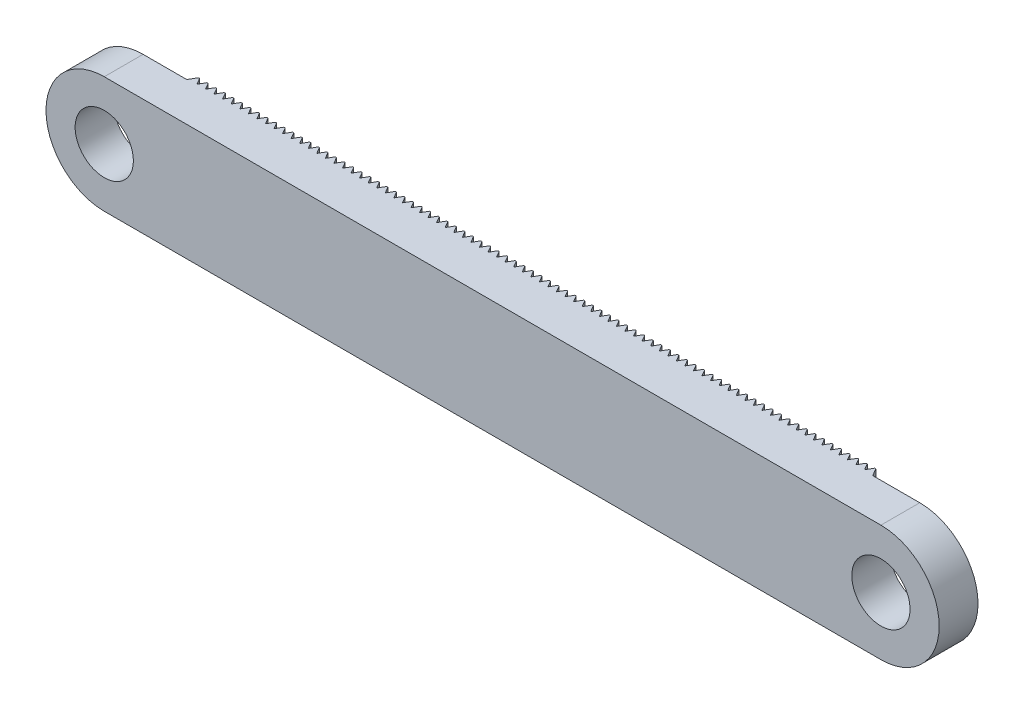
from build123d import *

# Parameters (mm, degrees)
SKETCH1_R           = 1.5
BOSS_EXTRUDE1_DEPTH = 2
BOSS_EXTRUDE6_DEPTH = 3


with BuildPart() as part:
    # Sketch1 → Boss-Extrude1 (new body)
    with BuildSketch(Plane.XY):
        with BuildLine():
            Line((-20, 3), (20, 3))
            ThreePointArc((20, 3), (23, 0), (20, -3))
            Line((20, -3), (-20, -3))
            ThreePointArc((-20, -3), (-23, 0), (-20, 3))
        make_face()
        with Locations((-20, 0)):
            Circle(SKETCH1_R, mode=Mode.SUBTRACT)
        with Locations(Location((20, 0, 0), (0, 0, 180))):
            Circle(SKETCH1_R, mode=Mode.SUBTRACT)
    extrude(amount=BOSS_EXTRUDE1_DEPTH)

    # Sketch5 → Boss-Extrude6 (add, symmetric)
    with BuildSketch(Plane(origin=(0, 0, 0), x_dir=(1, 0, 0), z_dir=(0, 1, 0))):
        Polygon((-17.469393102, 0.38), (-17.530606898, 0.38), (-17.75, 0), (17.576728926, 0), (17.357335823, 0.38), (17.296122028, 0.38), (17.106306591, 0.051230019), (16.916491153, 0.38), (16.855277358, 0.38), (16.665461921, 0.051230019), (16.475646483, 0.38), (16.414432688, 0.38), (16.224617251, 0.051230019), (16.034801814, 0.38), (15.973588018, 0.38), (15.783772581, 0.051230019), (15.593957144, 0.38), (15.532743348, 0.38), (15.342927911, 0.051230019), (15.153112474, 0.38), (15.091898678, 0.38), (14.902083241, 0.051230019), (14.712267804, 0.38), (14.651054008, 0.38), (14.461238571, 0.051230019), (14.271423134, 0.38), (14.210209338, 0.38), (14.020393901, 0.051230019), (13.830578464, 0.38), (13.769364668, 0.38), (13.579549231, 0.051230019), (13.389733794, 0.38), (13.328519998, 0.38), (13.138704561, 0.051230019), (12.948889124, 0.38), (12.887675329, 0.38), (12.697859891, 0.051230019), (12.508044454, 0.38), (12.446830659, 0.38), (12.257015221, 0.051230019), (12.067199784, 0.38), (12.005985989, 0.38), (11.816170551, 0.051230019), (11.626355114, 0.38), (11.565141319, 0.38), (11.375325881, 0.051230019), (11.185510444, 0.38), (11.124296649, 0.38), (10.934481211, 0.051230019), (10.744665774, 0.38), (10.683451979, 0.38), (10.493636542, 0.051230019), (10.303821104, 0.38), (10.242607309, 0.38), (10.052791872, 0.051230019), (9.862976434, 0.38), (9.801762639, 0.38), (9.611947202, 0.051230019), (9.422131764, 0.38), (9.360917969, 0.38), (9.171102532, 0.051230019), (8.981287094, 0.38), (8.920073299, 0.38), (8.730257862, 0.051230019), (8.540442424, 0.38), (8.479228629, 0.38), (8.289413192, 0.051230019), (8.099597755, 0.38), (8.038383959, 0.38), (7.848568522, 0.051230019), (7.658753085, 0.38), (7.597539289, 0.38), (7.407723852, 0.051230019), (7.217908415, 0.38), (7.156694619, 0.38), (6.966879182, 0.051230019), (6.777063745, 0.38), (6.715849949, 0.38), (6.526034512, 0.051230019), (6.336219075, 0.38), (6.275005279, 0.38), (6.085189842, 0.051230019), (5.895374405, 0.38), (5.834160609, 0.38), (5.644345172, 0.051230019), (5.454529735, 0.38), (5.393315939, 0.38), (5.203500502, 0.051230019), (5.013685065, 0.38), (4.952471269, 0.38), (4.762655832, 0.051230019), (4.572840395, 0.38), (4.5116266, 0.38), (4.321811162, 0.051230019), (4.131995725, 0.38), (4.07078193, 0.38), (3.880966492, 0.051230019), (3.691151055, 0.38), (3.62993726, 0.38), (3.440121822, 0.051230019), (3.250306385, 0.38), (3.18909259, 0.38), (2.999277152, 0.051230019), (2.809461715, 0.38), (2.74824792, 0.38), (2.558432483, 0.051230019), (2.368617045, 0.38), (2.30740325, 0.38), (2.117587813, 0.051230019), (1.927772375, 0.38), (1.86655858, 0.38), (1.676743143, 0.051230019), (1.486927705, 0.38), (1.42571391, 0.38), (1.235898473, 0.051230019), (1.046083035, 0.38), (0.98486924, 0.38), (0.795053803, 0.051230019), (0.605238365, 0.38), (0.54402457, 0.38), (0.354209133, 0.051230019), (0.164393696, 0.38), (0.1031799, 0.38), (-0.086635537, 0.051230019), (-0.276450974, 0.38), (-0.33766477, 0.38), (-0.527480207, 0.051230019), (-0.717295644, 0.38), (-0.77850944, 0.38), (-0.968324877, 0.051230019), (-1.158140314, 0.38), (-1.21935411, 0.38), (-1.409169547, 0.051230019), (-1.598984984, 0.38), (-1.66019878, 0.38), (-1.850014217, 0.051230019), (-2.039829654, 0.38), (-2.10104345, 0.38), (-2.290858887, 0.051230019), (-2.480674324, 0.38), (-2.54188812, 0.38), (-2.731703557, 0.051230019), (-2.921518994, 0.38), (-2.98273279, 0.38), (-3.172548227, 0.051230019), (-3.362363664, 0.38), (-3.423577459, 0.38), (-3.613392897, 0.051230019), (-3.803208334, 0.38), (-3.864422129, 0.38), (-4.054237567, 0.051230019), (-4.244053004, 0.38), (-4.305266799, 0.38), (-4.495082237, 0.051230019), (-4.684897674, 0.38), (-4.746111469, 0.38), (-4.935926907, 0.051230019), (-5.125742344, 0.38), (-5.186956139, 0.38), (-5.376771577, 0.051230019), (-5.566587014, 0.38), (-5.627800809, 0.38), (-5.817616246, 0.051230019), (-6.007431684, 0.38), (-6.068645479, 0.38), (-6.258460916, 0.051230019), (-6.448276354, 0.38), (-6.509490149, 0.38), (-6.699305586, 0.051230019), (-6.889121024, 0.38), (-6.950334819, 0.38), (-7.140150256, 0.051230019), (-7.329965694, 0.38), (-7.391179489, 0.38), (-7.580994926, 0.051230019), (-7.770810363, 0.38), (-7.832024159, 0.38), (-8.021839596, 0.051230019), (-8.211655033, 0.38), (-8.272868829, 0.38), (-8.462684266, 0.051230019), (-8.652499703, 0.38), (-8.713713499, 0.38), (-8.903528936, 0.051230019), (-9.093344373, 0.38), (-9.154558169, 0.38), (-9.344373606, 0.051230019), (-9.534189043, 0.38), (-9.595402839, 0.38), (-9.785218276, 0.051230019), (-9.975033713, 0.38), (-10.036247509, 0.38), (-10.226062946, 0.051230019), (-10.415878383, 0.38), (-10.477092179, 0.38), (-10.666907616, 0.051230019), (-10.856723053, 0.38), (-10.917936849, 0.38), (-11.107752286, 0.051230019), (-11.297567723, 0.38), (-11.358781518, 0.38), (-11.548596956, 0.051230019), (-11.738412393, 0.38), (-11.799626188, 0.38), (-11.989441626, 0.051230019), (-12.179257063, 0.38), (-12.240470858, 0.38), (-12.430286296, 0.051230019), (-12.620101733, 0.38), (-12.681315528, 0.38), (-12.871130966, 0.051230019), (-13.060946403, 0.38), (-13.122160198, 0.38), (-13.311975636, 0.051230019), (-13.501791073, 0.38), (-13.563004868, 0.38), (-13.752820305, 0.051230019), (-13.942635743, 0.38), (-14.003849538, 0.38), (-14.193664975, 0.051230019), (-14.383480413, 0.38), (-14.444694208, 0.38), (-14.634509645, 0.051230019), (-14.824325083, 0.38), (-14.885538878, 0.38), (-15.075354315, 0.051230019), (-15.265169753, 0.38), (-15.326383548, 0.38), (-15.516198985, 0.051230019), (-15.706014423, 0.38), (-15.767228218, 0.38), (-15.957043655, 0.051230019), (-16.146859092, 0.38), (-16.208072888, 0.38), (-16.397888325, 0.051230019), (-16.587703762, 0.38), (-16.648917558, 0.38), (-16.838732995, 0.051230019), (-17.028548432, 0.38), (-17.089762228, 0.38), (-17.279577665, 0.051230019), align=None)
    extrude(amount=BOSS_EXTRUDE6_DEPTH, both=True)


solid = part.part
